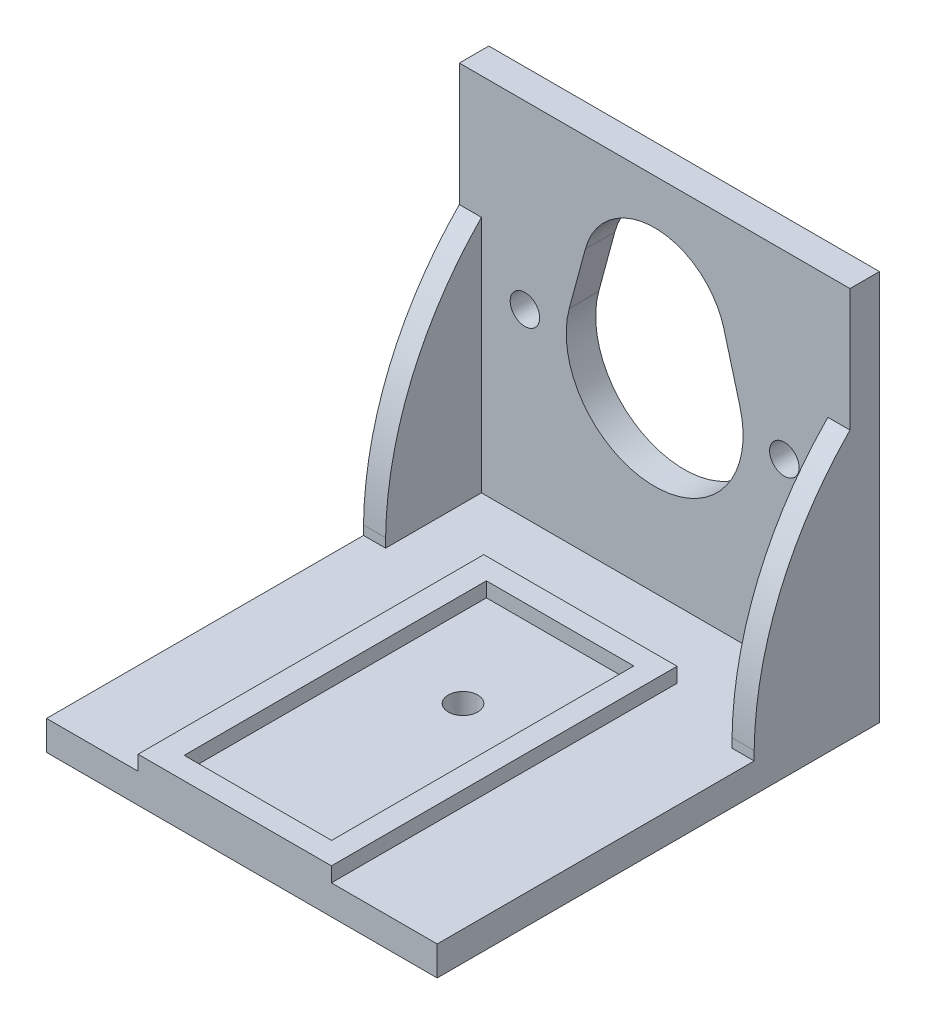
from build123d import *

# Parameters (mm, degrees)
ESBO_O1_W                  = 53
ESBO_O1_H                  = 53
RESSALTO_EXTRUS_O1_DEPTH   = 4
ESBO_O2_W                  = 53
ESBO_O2_H                  = 4
RESSALTO_EXTRUS_O2_DEPTH   = 60
CORTE_EXTRUS_O1_DEPTH      = 21
CORTE_EXTRUS_O1_DEPTH_BACK = 18
CORTE_EXTRUS_O2_DEPTH      = 17
CORTE_EXTRUS_O2_DEPTH_BACK = 15
ESBO_O4_R                  = 2
ESBO_O5_W                  = 3
ESBO_O5_H                  = 36.373853852
RESSALTO_EXTRUS_O3_DEPTH   = 17
CORTE_EXTRUS_O3_DEPTH      = 62
CORTE_EXTRUS_O3_DEPTH_BACK = 15
ESBO_O7_W                  = 26.228570329
ESBO_O7_H                  = 46.898944641
ESBO_O7_W_2                = 20
ESBO_O7_H_2                = 41
RESSALTO_EXTRUS_O4_DEPTH   = 6
CORTE_EXTRUS_O4_DEPTH      = 10
CORTE_EXTRUS_O4_DEPTH_BACK = 21
ESBO_O8_R                  = 2


with BuildPart() as part:
    # Esboço1 → Ressalto-extrusão1 (new body)
    with BuildSketch(Plane.XY):
        with Locations((26.5, 26.5)):
            Rectangle(ESBO_O1_W, ESBO_O1_H)
    extrude(amount=RESSALTO_EXTRUS_O1_DEPTH)

    # Esboço2 → Ressalto-extrusão2 (add)
    with BuildSketch(Plane.XY):
        with Locations((26.5, 2)):
            Rectangle(ESBO_O2_W, ESBO_O2_H)
    extrude(amount=RESSALTO_EXTRUS_O2_DEPTH)

    # Esboço3 → Corte-extrusão1 (cut, two sides: drawn at the far end of the back side and taken through both)
    with BuildSketch(Plane.XY.offset(-CORTE_EXTRUS_O1_DEPTH_BACK)):
        with BuildLine():
            Line((17.098198891, 39.704586726), (14.91581435, 31.631555975))
            ThreePointArc((14.91581435, 31.631555975), (26.5, 16.5), (38.08418565, 31.631555975))
            Line((38.08418565, 31.631555975), (35.901801109, 39.704586726))
            ThreePointArc((35.901801109, 39.704586726), (26.5, 46.902274107), (17.098198891, 39.704586726))
        make_face()
    extrude(amount=CORTE_EXTRUS_O1_DEPTH + CORTE_EXTRUS_O1_DEPTH_BACK, mode=Mode.SUBTRACT)

    # Esboço4 → Corte-extrusão2 (cut, two sides: drawn at the far end of the back side and taken through both)
    with BuildSketch(Plane.XY.offset(-CORTE_EXTRUS_O2_DEPTH_BACK)):
        with Locations((8.9, 28.5)):
            Circle(ESBO_O4_R)
        with Locations((44.1, 28.5)):
            Circle(ESBO_O4_R)
    extrude(amount=CORTE_EXTRUS_O2_DEPTH + CORTE_EXTRUS_O2_DEPTH_BACK, mode=Mode.SUBTRACT)

    # Esboço5 → Ressalto-extrusão3 (add)
    with BuildSketch(Plane.XY):
        with Locations((1.5, 18.186926926)):
            Rectangle(ESBO_O5_W, ESBO_O5_H)
        with Locations((51.5, 18.186926926)):
            Rectangle(ESBO_O5_W, ESBO_O5_H)
    extrude(amount=RESSALTO_EXTRUS_O3_DEPTH)

    # Esboço6 → Corte-extrusão3 (cut, two sides: drawn at the far end of the back side and taken through both)
    with BuildSketch(Plane(origin=(0, 0, 0), x_dir=(0, 0, -1), z_dir=(1, 0, 0)).offset(-CORTE_EXTRUS_O3_DEPTH_BACK)):
        with BuildLine():
            ThreePointArc((-17, 5.226597996), (-13.510052949, 22.056538471), (-4, 36.373853852))
            Line((-4, 36.373853852), (-17, 36.373853852))
            Line((-17, 36.373853852), (-17, 5.226597996))
        make_face()
    extrude(amount=CORTE_EXTRUS_O3_DEPTH + CORTE_EXTRUS_O3_DEPTH_BACK, mode=Mode.SUBTRACT)

    # Esboço7 → Ressalto-extrusão4 (add)
    with BuildSketch(Plane(origin=(0, 0, 0), x_dir=(1, 0, 0), z_dir=(0, 1, 0))):
        with Locations((25.531831297, -36.55052768)):
            Rectangle(ESBO_O7_W, ESBO_O7_H)
        with Locations((25.674113589, -36.5)):
            Rectangle(ESBO_O7_W_2, ESBO_O7_H_2, mode=Mode.SUBTRACT)
    extrude(amount=RESSALTO_EXTRUS_O4_DEPTH)

    # Esboço8 → Corte-extrusão4 (cut, two sides: drawn at the far end of the back side and taken through both)
    with BuildSketch(Plane(origin=(0, 0, 0), x_dir=(1, 0, 0), z_dir=(0, 1, 0)).offset(-CORTE_EXTRUS_O4_DEPTH_BACK)):
        with Locations((26.5, -30)):
            Circle(ESBO_O8_R)
    extrude(amount=CORTE_EXTRUS_O4_DEPTH + CORTE_EXTRUS_O4_DEPTH_BACK, mode=Mode.SUBTRACT)


solid = part.part
